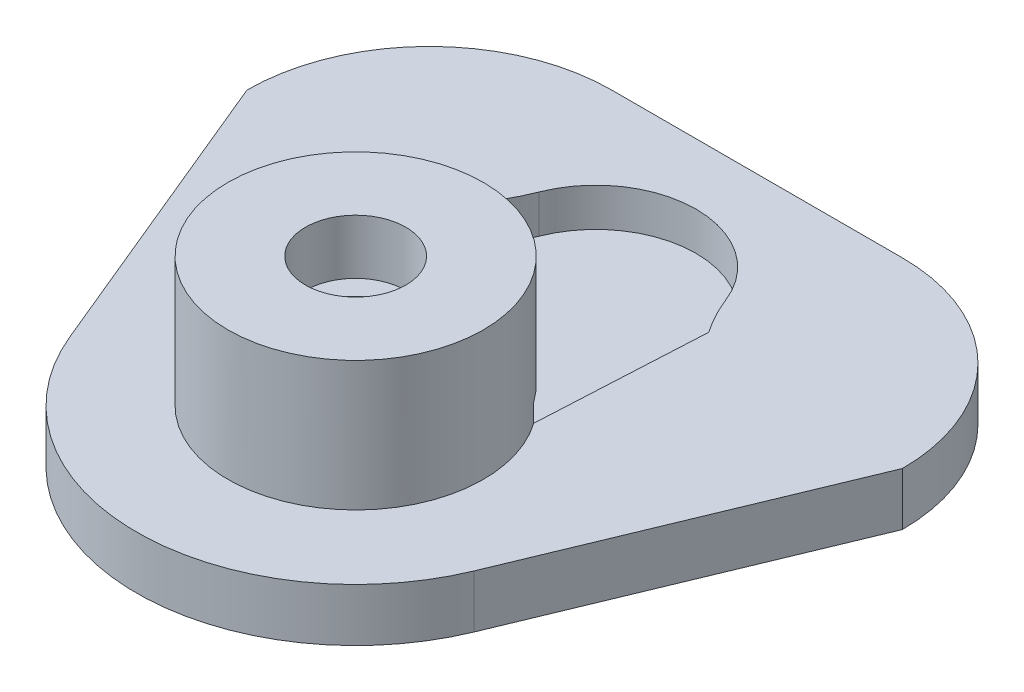
from build123d import *
from build123d.topology import SkipClean

# Parameters (mm, degrees)
SKETCH1_R           = 12
SKETCH1_R_2         = 7
SKETCH1_R_3         = 5.5
BOSS_EXTRUDE1_DEPTH = 2.9
SKETCH1_3_R         = 7
SKETCH1_3_R_2       = 5.5
BOSS_EXTRUDE2_DEPTH = 10
SKETCH2_R           = 5.5
CUT_EXTRUDE2_DEPTH  = 1
SKETCH3_R           = 5.5
CUT_EXTRUDE3_DEPTH  = 1
CUT_EXTRUDE4_START  = -2.5
SKETCH3_4_R         = 5.5
CUT_EXTRUDE4_DEPTH  = 2.5
CUT_EXTRUDE6_REACH  = 32.109
SKETCH5_R           = 1.55
CUT_EXTRUDE7_START  = -2.1
CUT_EXTRUDE7_DEPTH  = 2.1
SKETCH6_R           = 5.5
CUT_EXTRUDE8_DEPTH  = 2.1
FILLET1_R           = 10
SKETCH5_3_R         = 2.75
SKETCH5_3_R_2       = 1.55
CUT_EXTRUDE9_DEPTH  = 3


with BuildPart() as part:
    # Sketch1 → Boss-Extrude1 (new body)
    # profile 1 of 4: a face of its own
    with BuildSketch(Plane(origin=(0, 0, 0), x_dir=(1, 0, 0), z_dir=(0, 1, 0))):
        Circle(SKETCH1_R)
        Circle(SKETCH1_R_2, mode=Mode.SUBTRACT)
    # profile 2 of 4: a face of its own
    with BuildSketch(Plane(origin=(0, 0, 0), x_dir=(1, 0, 0), z_dir=(0, 1, 0))):
        with BuildLine():
            ThreePointArc((12, -2.94e-15), (11.769423369196444, -2.341083842286014), (11.086554407231223, -4.592201147108209))
            Line((11.086554407231223, -4.592201147108209), (17.959269151985882, 12))
            Line((17.959269151985882, 12), (17.959269151985882, 12.009999999999998))
            ThreePointArc((17.959269151985882, 12.009999999999998), (15.033265896039495, 19.07399674405361), (7.969269151985883, 21.999999999999996))
            Line((7.969269151985883, 21.999999999999996), (-7.969269151985883, 21.999999999999996))
            ThreePointArc((-7.969269151985883, 21.999999999999993), (-15.033265896039492, 19.07399674405361), (-17.959269151985882, 12.009999999999998))
            Line((-17.959269151985882, 12.009999999999998), (-17.959269151985882, 12))
            Line((-17.95926915198589, 12.000000000000014), (-11.086554257092926, -4.592201509574117))
            ThreePointArc((-11.08655425709292, -4.592201509574119), (-2.3410840346818973, 11.769423330926521), (12, 0))
        make_face()
    # profile 3 of 4: a face of its own
    with BuildSketch(Plane(origin=(0, 0, 0), x_dir=(1, 0, 0), z_dir=(0, 1, 0))):
        Circle(SKETCH1_R_2)
    # profile 4 of 4: a face of its own
    with BuildSketch(Plane(origin=(0, 0, 0), x_dir=(1, 0, 0), z_dir=(0, 1, 0))):
        Circle(SKETCH1_R_3)
    extrude(amount=BOSS_EXTRUDE1_DEPTH)

    # Sketch1<3> → Boss-Extrude2 (add)
    with BuildSketch(Plane(origin=(0, 0, 0), x_dir=(1, 0, 0), z_dir=(0, 1, 0))):
        with Locations(Location((0, 0, 0), (0, 0, 270))):
            Circle(SKETCH1_3_R)
        Circle(SKETCH1_3_R_2)
    extrude(amount=BOSS_EXTRUDE2_DEPTH)

    # Sketch2 → Cut-Extrude2 (cut)
    with SkipClean():  # the faces are left unmerged after this step: merging them gives an invalid solid
        with BuildSketch(Plane(origin=(0, 2.9, 0), x_dir=(1, 0, 0), z_dir=(0, 1, 0))):
            with BuildLine():
                ThreePointArc((-5.500000000000162, 4.330127018921988), (-1.9852e-13, 7), (5.499999999999917, 4.330127018922298))
                Line((5.5, 4.330127018922322), (5.5, 11.712224753227023))
                Line((5.5, 11.712224753227023), (-5.5, 11.712224753227023))
                Line((-5.5, 11.712224753227023), (-5.5, 4.330127018921939))
            make_face()
            with Locations(Location((0, 0, 0), (0, 0, 270))):
                Circle(SKETCH2_R)
        extrude(amount=CUT_EXTRUDE2_DEPTH, mode=Mode.SUBTRACT)

    # Sketch3 → Cut-Extrude3 (cut)
    with BuildSketch(Plane(origin=(0, 2.9, 0), x_dir=(1, 0, 0), z_dir=(0, 1, 0))):
        Circle(SKETCH3_R)
        with BuildLine():
            ThreePointArc((-5.5, 3.12e-15), (1.56e-15, 5.5), (5.5, 0))
            Line((5.5, 0), (6.1896702982743115, 13.159693230837554))
            Line((6.1896702982743115, 13.159693230837554), (-6.189670298274319, 13.159693230837554))
            Line((-6.1896702982743195, 13.159693230837554), (-5.5, 0))
        make_face()
    extrude(amount=CUT_EXTRUDE3_DEPTH, mode=Mode.SUBTRACT)

    # Sketch3<4> → Cut-Extrude4 (cut)
    with SkipClean():  # the faces are left unmerged after this step: merging them gives an invalid solid
        with BuildSketch(Plane(origin=(0, 2.9, 0), x_dir=(1, 0, 0), z_dir=(0, 1, 0)).offset(CUT_EXTRUDE4_START)):
            with Locations(Location((0, 0, 0), (0, 0, 180))):
                Circle(SKETCH3_4_R)
        extrude(amount=CUT_EXTRUDE4_DEPTH, mode=Mode.SUBTRACT)

    # Sketch5 → Cut-Extrude6 (cut, up to next)
    with BuildSketch(Plane(origin=(0, 10, 0), x_dir=(1, 0, 0), z_dir=(0, 1, 0)), mode=Mode.PRIVATE) as cut_extrude6_sk1:
        with Locations(Location((0, 0, 0), (0, 0, 270))):
            Circle(SKETCH5_R)
    cut_extrude6_tool1 = extrude(cut_extrude6_sk1.sketch, amount=-CUT_EXTRUDE6_REACH, mode=Mode.PRIVATE) & part.part
    add(cut_extrude6_tool1.solids().sort_by_distance((0, 10, 0))[0], mode=Mode.SUBTRACT)

    # Sketch3<5> → Cut-Extrude7 (cut)
    with BuildSketch(Plane(origin=(0, 2.9, 0), x_dir=(1, 0, 0), z_dir=(0, 1, 0)).offset(CUT_EXTRUDE7_START)):
        with BuildLine():
            ThreePointArc((-5.5, 3.12e-15), (1.56e-15, 5.5), (5.5, 0))
            Line((5.5, 0), (6.1896702982743115, 13.159693230837554))
            Line((6.1896702982743115, 13.159693230837554), (-6.189670298274319, 13.159693230837554))
            Line((-6.1896702982743195, 13.159693230837554), (-5.5, 0))
        make_face()
    extrude(amount=CUT_EXTRUDE7_DEPTH, mode=Mode.SUBTRACT)

    # Sketch6 → Cut-Extrude8 (cut)
    with BuildSketch(Plane(origin=(0, 2.9, 0), x_dir=(1, 0, 0), z_dir=(0, 1, 0))):
        with Locations((-4.34e-15, 13.159693230837554)):
            Circle(SKETCH6_R)
    extrude(amount=-CUT_EXTRUDE8_DEPTH, mode=Mode.SUBTRACT)

    # Fillet1
    # the kernel refuses this fillet: 10 mm, written as the material it takes off along each edge
    with BuildSketch(Plane(origin=(5.499999999999996, 8.022933245127838, -13.159693230837554), x_dir=(1, 0, 0), z_dir=(0, -1, 0))) as fillet1_piece_1:
        with BuildLine():
            CenterArc((8.924194649844473, -5.6738530738289406), FILLET1_R, 145.43190419239474, 13.095569895078825)
            ThreePointArc((-0.3817373823132515, -2.01330270361672), (-0.09627700574515341, -1.0245866490255686), (0, 0))
            Line((0, 0), (0.6896702982743177, 0))
        make_face()
    extrude(amount=7.222933245127838, mode=Mode.SUBTRACT)
    with BuildSketch(Plane(origin=(-5.500000000000004, 0.7999999999999998, -13.159693230837554), x_dir=(0.18628848164101172, 0, -0.9824950898645174), z_dir=(0, 1, 0))) as fillet1_piece_2:
        with BuildLine():
            CenterArc((3.9120581144612516, 9.824950898645172), FILLET1_R, 246.168167148658, 13.095569895078825)
            Line((-0.12847763269842533, 0.6775976816799091), (0, 0))
            ThreePointArc((0, 0), (1.0245866490255648, 0.09627700574515353), (2.0491732980511315, -1e-17))
        make_face()
    extrude(amount=7.222933245127831, mode=Mode.SUBTRACT)

    # Sketch5<3> → Cut-Extrude9 (cut)
    with BuildSketch(Plane(origin=(0, 10, 0), x_dir=(1, 0, 0), z_dir=(0, 1, 0))):
        with Locations(Location((0, 0, 0), (0, 0, 270))):
            Circle(SKETCH5_3_R)
        with Locations(Location((0, 0, 0), (0, 0, 270))):
            Circle(SKETCH5_3_R_2, mode=Mode.SUBTRACT)
    extrude(amount=-CUT_EXTRUDE9_DEPTH, mode=Mode.SUBTRACT)


solid = part.part
